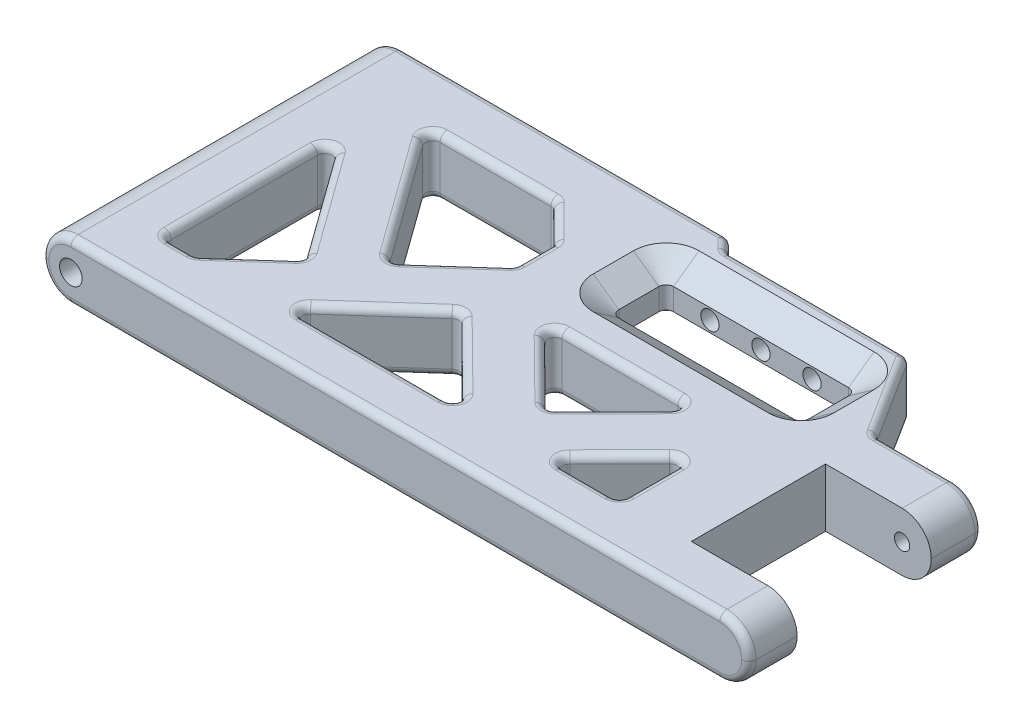
from build123d import *
from OCP.BRepFilletAPI import BRepFilletAPI_MakeChamfer

# Parameters (mm, degrees)
BOSS_EXTRU_1_DEPTH                            = 4
BOSS_EXTRU_1_DEPTH_BACK                       = 4
CONG_1_R                                      = 4
CONG_2_R                                      = 1
CHANFREIN2_SIZE                               = 3.5
CHANFREIN2_SIZE2                              = 2.5
CHANFREIN3_SIZE                               = 2.5
CHANFREIN3_SIZE2                              = 3.5
ENL_V_MAT_EXTRU_1_DEPTH                       = 21.75
ENL_V_MAT_EXTRU_1_DEPTH_BACK                  = 100.712398932
ESQUISSE6_R                                   = 1.05
ENL_V_MAT_EXTRU_2_DEPTH                       = 100.712398932
ENL_V_MAT_EXTRU_2_DEPTH_BACK                  = 100.712398932
ESQUISSE10_R                                  = 1.55
TROU_TARAUD_M31_D                             = 2.5
TROU_TARAUD_M31_DEPTH                         = 16
TROU_TARAUD_M31_TIP                           = 0.751075774
TROU_POUR_TARAUDAGE_POUR_TROU_TARAUD_M3_D     = 2.7
TROU_POUR_TARAUDAGE_POUR_TROU_TARAUD_M3_DEPTH = 3
TROU_POUR_TARAUDAGE_POUR_TROU_TARAUD_M3_TIP   = 0.811161836


with BuildPart() as part:
    # Esquisse1 → Boss.-Extru.1 (new, two sides: drawn at the far end of the back side and taken through both)
    with BuildSketch(Plane(origin=(0, 0, 0), x_dir=(1, 0, 0), z_dir=(0, 1, 0)).offset(-BOSS_EXTRU_1_DEPTH_BACK)):
        with BuildLine():
            Line((97, 2.25), (97, 9.25))
            Line((97, 9.25), (83, 9.25))
            ThreePointArc((83, 9.25), (82.517410597, 9.374153285), (82.154651314, 9.715785063))
            Line((82.154651314, 9.715785063), (75.381179686, 20.434214937))
            ThreePointArc((75.381179686, 20.434214937), (75.018420403, 20.775846715), (74.535831, 20.9))
            Line((74.535831, 20.9), (50.90856897, 20.9))
            ThreePointArc((50.90856897, 20.9), (50.520605187, 20.978325381), (50.193416227, 21.201031793))
            Line((50.193416227, 21.201031793), (48.973721713, 22.448968207))
            ThreePointArc((48.973721713, 22.448968207), (48.646532753, 22.671674619), (48.25856897, 22.75))
            Line((48.25856897, 22.75), (0, 22.75))
            Line((0, 22.75), (0, -22.75))
            Line((0, -22.75), (97, -22.75))
            Line((97, -22.75), (97, -16.15))
            Line((97, -16.15), (82.5, -16.15))
            Line((82.5, -16.15), (82.5, 2.25))
            Line((82.5, 2.25), (97, 2.25))
        make_face()
        with BuildLine():
            Line((32.085786438, 15), (16.886496815, 15))
            ThreePointArc((16.886496815, 15), (15.996263739, 14.455505292), (16.075485061, 13.414970141))
            Line((16.075485061, 13.414970141), (27.680020432, -2.672096946))
            ThreePointArc((27.680020432, -2.672096946), (28.38275435, -3.081187759), (29.157080518, -2.832975673))
            Line((29.157080518, -2.832975673), (37.166048333, 4.318516825))
            ThreePointArc((37.166048333, 4.318516825), (37.412701576, 4.655798646), (37.5, 5.064425411))
            Line((37.5, 5.064425411), (37.5, 9.585786438))
            ThreePointArc((37.5, 9.585786438), (37.423879533, 9.96846987), (37.207106781, 10.292893219))
            Line((37.207106781, 10.292893219), (32.792893219, 14.707106781))
            ThreePointArc((32.792893219, 14.707106781), (32.46846987, 14.923879533), (32.085786438, 15))
        make_face(mode=Mode.SUBTRACT)
        with BuildLine():
            Line((21.80245122, -8.19869057), (11.811011754, 5.652183408))
            ThreePointArc((11.811011754, 5.652183408), (10.692601036, 6.018734275), (10, 5.067153549))
            Line((10, 5.067153549), (10, -15))
            ThreePointArc((10, -15), (10.292893219, -15.707106781), (11, -16))
            Line((11, -16), (14.029818095, -16))
            ThreePointArc((14.029818095, -16), (14.386252811, -15.93432023), (14.695866427, -15.745908586))
            Line((14.695866427, -15.745908586), (21.657487799, -9.529629014))
            ThreePointArc((21.657487799, -9.529629014), (21.985560138, -8.891998264), (21.80245122, -8.19869057))
        make_face(mode=Mode.SUBTRACT)
        with BuildLine():
            Line((38.631997686, -5.097659646), (28.377695197, -14.254091414))
            ThreePointArc((28.377695197, -14.254091414), (28.109423299, -15.356434716), (29.04374353, -16))
            Line((29.04374353, -16), (48.565566376, -16))
            ThreePointArc((48.565566376, -16), (49.490595403, -15.379896431), (49.268396828, -14.288642597))
            Line((49.268396828, -14.288642597), (40.000876471, -5.132210828))
            ThreePointArc((40.000876471, -5.132210828), (39.323278481, -4.843886621), (38.631997686, -5.097659646))
        make_face(mode=Mode.SUBTRACT)
        with BuildLine():
            Line((47.921066285, -1.711357403), (55.94632476, -9.640418125))
            ThreePointArc((55.94632476, -9.640418125), (56.655184678, -9.929042544), (57.360512616, -9.631891174))
            Line((57.360512616, -9.631891174), (65.194528694, -1.702830452))
            ThreePointArc((65.194528694, -1.702830452), (65.405892932, -0.614533044), (64.483171291, 0))
            Line((64.483171291, 0), (48.623896738, 0))
            ThreePointArc((48.623896738, 0), (47.69886771, -0.620103569), (47.921066285, -1.711357403))
        make_face(mode=Mode.SUBTRACT)
        with BuildLine():
            Line((48.5, 15.4), (72.5, 15.4))
            ThreePointArc((72.5, 15.4), (73.207106781, 15.107106781), (73.5, 14.4))
            Line((73.5, 14.4), (73.5, 8.9))
            ThreePointArc((73.5, 8.9), (73.207106781, 8.192893219), (72.5, 7.9))
            Line((72.5, 7.9), (48.5, 7.9))
            ThreePointArc((48.5, 7.9), (47.792893219, 8.192893219), (47.5, 8.9))
            Line((47.5, 8.9), (47.5, 14.4))
            ThreePointArc((47.5, 14.4), (47.792893219, 15.107106781), (48.5, 15.4))
        make_face(mode=Mode.SUBTRACT)
        with BuildLine():
            Line((64.708618676, -16), (71.5, -16))
            ThreePointArc((71.5, -16), (72.207106781, -15.707106781), (72.5, -15))
            Line((72.5, -15), (72.5, -8.126223591))
            ThreePointArc((72.5, -8.126223591), (71.879896431, -7.201194564), (70.788642597, -7.423393139))
            Line((70.788642597, -7.423393139), (63.997261272, -14.297169548))
            ThreePointArc((63.997261272, -14.297169548), (63.785897035, -15.385466956), (64.708618676, -16))
        make_face(mode=Mode.SUBTRACT)
    extrude(amount=BOSS_EXTRU_1_DEPTH + BOSS_EXTRU_1_DEPTH_BACK)

    # Congé1
    cong_1_edges = [part.edges().sort_by_distance(p)[0] for p in [
        (0, 4, 0),
        (97, -4, -5.75),
        (97, -4, 19.45),
        (97, 4, 19.45),
        (97, 4, -5.75),
        (0, -4, 0),
    ]]
    fillet(cong_1_edges, radius=CONG_1_R - 0.0001)  # a hair under: the kernel refuses the full size

    # Congé2
    cong_2_edges = [part.edges().sort_by_distance(p)[0] for p in [
        (47.69886771, -4, 0.620103569),
        (56.553534014, -4, 0),
        (65.405892932, -4, 0.614533044),
        (61.277520655, -4, 5.667360813),
        (56.655184678, -4, 9.929042544),
        (51.933695523, -4, 5.675887764),
        (63.785897035, -4, 15.385466956),
        (67.392951935, -4, 10.860281343),
        (71.879896431, -4, 7.201194564),
        (72.5, -4, 11.563111796),
        (72.207106781, -4, 15.707106781),
        (68.104309338, -4, 16),
        (82.517410597, 4, -9.374153285),
        (78.7679155, 4, -15.075),
        (75.018420403, 4, -20.775846715),
        (62.722199985, 4, -20.9),
        (50.520605187, 4, -20.978325381),
        (49.58356897, 4, -21.825),
        (48.646532753, 4, -22.671674619),
        (26.129234485, 4, -22.75),
        (32.46846987, 4, -14.923879533),
        (24.486141626, 4, -15),
        (15.996263739, 4, -14.455505292),
        (21.877752746, 4, -5.371436598),
        (28.38275435, 4, 3.081187759),
        (33.161564425, 4, -0.742770576),
        (37.412701576, 4, -4.655798646),
        (37.5, 4, -7.325105925),
        (37.423879533, 4, -9.96846987),
        (35, 4, -12.5),
        (21.985560138, 4, 8.891998264),
        (16.806731487, 4, 1.273253581),
        (10.692601036, 4, -6.018734275),
        (10, 4, 4.966423225),
        (10.292893219, 4, 15.707106781),
        (12.514909047, 4, 16),
        (14.386252811, 4, 15.93432023),
        (18.176677113, 4, 12.6377688),
        (39.323278481, 4, 4.843886621),
        (33.504846441, 4, 9.67587553),
        (28.109423299, 4, 15.356434716),
        (38.804654953, 4, 16),
        (49.490595403, 4, 15.379896431),
        (44.634636649, 4, 9.710426713),
        (47.69886771, 4, 0.620103569),
        (51.933695523, 4, 5.675887764),
        (56.655184678, 4, 9.929042544),
        (61.277520655, 4, 5.667360813),
        (65.405892932, 4, 0.614533044),
        (56.553534014, 4, 0),
        (63.785897035, 4, 15.385466956),
        (68.104309338, 4, 16),
        (72.207106781, 4, 15.707106781),
        (72.5, 4, 11.563111796),
        (71.879896431, 4, 7.201194564),
        (67.392951935, 4, 10.860281343),
        (82.517410597, -4, -9.374153285),
        (88.00005, 4, -9.25),
        (88.00005, -4, -9.25),
        (95.828456414, 2.828456414, -9.25),
        (95.828456414, -2.828456414, -9.25),
        (78.7679155, -4, -15.075),
        (48.5, -4, 22.75),
        (48.5, 4, 22.75),
        (1.171543586, 2.828456414, 22.75),
        (1.171543586, -2.828456414, 22.75),
        (95.828456414, 2.828456414, 22.75),
        (95.828456414, -2.828456414, 22.75),
        (1.171543586, 2.828456414, -22.75),
        (1.171543586, -2.828456414, -22.75),
        (75.018420403, -4, -20.775846715),
        (62.722199985, -4, -20.9),
        (50.520605187, -4, -20.978325381),
        (49.58356897, -4, -21.825),
        (48.646532753, -4, -22.671674619),
        (32.46846987, -4, -14.923879533),
        (35, -4, -12.5),
        (37.423879533, -4, -9.96846987),
        (37.5, -4, -7.325105925),
        (37.412701576, -4, -4.655798646),
        (33.161564425, -4, -0.742770576),
        (28.38275435, -4, 3.081187759),
        (21.877752746, -4, -5.371436598),
        (26.129234485, -4, -22.75),
        (15.996263739, -4, -14.455505292),
        (24.486141626, -4, -15),
        (21.985560138, -4, 8.891998264),
        (18.176677113, -4, 12.6377688),
        (14.386252811, -4, 15.93432023),
        (12.514909047, -4, 16),
        (10.292893219, -4, 15.707106781),
        (10, -4, 4.966423225),
        (10.692601036, -4, -6.018734275),
        (16.806731487, -4, 1.273253581),
        (39.323278481, -4, 4.843886621),
        (44.634636649, -4, 9.710426713),
        (49.490595403, -4, 15.379896431),
        (38.804654953, -4, 16),
        (28.109423299, -4, 15.356434716),
        (33.504846441, -4, 9.67587553),
    ]]
    fillet(cong_2_edges, radius=CONG_2_R)

    # Chanfrein2
    chanfrein2_edges = [part.edges().sort_by_distance(p)[0] for p in [
        (47.792893219, 4, -15.107106781),
        (47.5, 4, -11.65),
        (47.792893219, 4, -8.192893219),
        (60.5, 4, -7.9),
        (73.207106781, 4, -8.192893219),
        (73.5, 4, -11.65),
        (73.207106781, 4, -15.107106781),
        (60.5, 4, -15.4),
    ]]
    chanfrein2_side = [part.faces().sort_by_distance(p)[0] for p in [
        (46.216457966, 4, 0.985552586),
    ]]
    chamfer(chanfrein2_edges, length=CHANFREIN2_SIZE, length2=CHANFREIN2_SIZE2, reference=chanfrein2_side[0])

    # Chanfrein3: one chamfer whose edges measure the first distance from different faces: ONE call of the kernel's chamfer builder (chamfer() names one face for all edges)
    chanfrein3_edges_1 = [part.edges().sort_by_distance(p)[0] for p in [
        (47.792893219, -4, -15.107106781),
    ]]
    chanfrein3_side_1 = [part.faces().sort_by_distance(p)[0] for p in [
        (47.792893219, -1.25, -15.107106781),
    ]]
    chanfrein3_edges_2 = [part.edges().sort_by_distance(p)[0] for p in [
        (60.5, -4, -15.4),
    ]]
    chanfrein3_side_2 = [part.faces().sort_by_distance(p)[0] for p in [
        (60.5, -1.25, -15.4),
    ]]
    chanfrein3_edges_3 = [part.edges().sort_by_distance(p)[0] for p in [
        (73.207106781, -4, -15.107106781),
    ]]
    chanfrein3_side_3 = [part.faces().sort_by_distance(p)[0] for p in [
        (73.207106781, -1.25, -15.107106781),
    ]]
    chanfrein3_edges_4 = [part.edges().sort_by_distance(p)[0] for p in [
        (73.5, -4, -11.65),
    ]]
    chanfrein3_side_4 = [part.faces().sort_by_distance(p)[0] for p in [
        (73.5, -1.25, -11.65),
    ]]
    chanfrein3_edges_5 = [part.edges().sort_by_distance(p)[0] for p in [
        (73.207106781, -4, -8.192893219),
    ]]
    chanfrein3_side_5 = [part.faces().sort_by_distance(p)[0] for p in [
        (73.207106781, -1.25, -8.192893219),
    ]]
    chanfrein3_edges_6 = [part.edges().sort_by_distance(p)[0] for p in [
        (60.5, -4, -7.9),
    ]]
    chanfrein3_side_6 = [part.faces().sort_by_distance(p)[0] for p in [
        (60.5, -1.25, -7.9),
    ]]
    chanfrein3_edges_7 = [part.edges().sort_by_distance(p)[0] for p in [
        (47.792893219, -4, -8.192893219),
    ]]
    chanfrein3_side_7 = [part.faces().sort_by_distance(p)[0] for p in [
        (47.792893219, -1.25, -8.192893219),
    ]]
    chanfrein3_edges_8 = [part.edges().sort_by_distance(p)[0] for p in [
        (47.5, -4, -11.65),
    ]]
    chanfrein3_side_8 = [part.faces().sort_by_distance(p)[0] for p in [
        (47.5, -1.25, -11.65),
    ]]
    chanfrein3 = BRepFilletAPI_MakeChamfer(part.part.solid().wrapped)
    for e in chanfrein3_edges_1:
        chanfrein3.Add(CHANFREIN3_SIZE, CHANFREIN3_SIZE2, e.wrapped, chanfrein3_side_1[0].wrapped)  # the first distance lies on this face
    for e in chanfrein3_edges_2:
        chanfrein3.Add(CHANFREIN3_SIZE, CHANFREIN3_SIZE2, e.wrapped, chanfrein3_side_2[0].wrapped)  # the first distance lies on this face
    for e in chanfrein3_edges_3:
        chanfrein3.Add(CHANFREIN3_SIZE, CHANFREIN3_SIZE2, e.wrapped, chanfrein3_side_3[0].wrapped)  # the first distance lies on this face
    for e in chanfrein3_edges_4:
        chanfrein3.Add(CHANFREIN3_SIZE, CHANFREIN3_SIZE2, e.wrapped, chanfrein3_side_4[0].wrapped)  # the first distance lies on this face
    for e in chanfrein3_edges_5:
        chanfrein3.Add(CHANFREIN3_SIZE, CHANFREIN3_SIZE2, e.wrapped, chanfrein3_side_5[0].wrapped)  # the first distance lies on this face
    for e in chanfrein3_edges_6:
        chanfrein3.Add(CHANFREIN3_SIZE, CHANFREIN3_SIZE2, e.wrapped, chanfrein3_side_6[0].wrapped)  # the first distance lies on this face
    for e in chanfrein3_edges_7:
        chanfrein3.Add(CHANFREIN3_SIZE, CHANFREIN3_SIZE2, e.wrapped, chanfrein3_side_7[0].wrapped)  # the first distance lies on this face
    for e in chanfrein3_edges_8:
        chanfrein3.Add(CHANFREIN3_SIZE, CHANFREIN3_SIZE2, e.wrapped, chanfrein3_side_8[0].wrapped)  # the first distance lies on this face
    add(Compound.cast(chanfrein3.Shape()), mode=Mode.REPLACE)

    # Esquisse6 → Enlèv. mat.-Extru.1 (cut, two sides: drawn at the far end of the back side and taken through both)
    with BuildSketch(Plane.XY.offset(-ENL_V_MAT_EXTRU_1_DEPTH_BACK)):
        with Locations((93, 0)):
            Circle(ESQUISSE6_R)
    extrude(amount=ENL_V_MAT_EXTRU_1_DEPTH + ENL_V_MAT_EXTRU_1_DEPTH_BACK, mode=Mode.SUBTRACT)

    # Esquisse10 → Enlèv. mat.-Extru.2 (cut, two sides: drawn at the far end of the back side and taken through both)
    with BuildSketch(Plane.XY.offset(-ENL_V_MAT_EXTRU_2_DEPTH_BACK)):
        with Locations((4, 0)):
            Circle(ESQUISSE10_R)
    extrude(amount=ENL_V_MAT_EXTRU_2_DEPTH + ENL_V_MAT_EXTRU_2_DEPTH_BACK, mode=Mode.SUBTRACT)

    # Trou taraudé M31
    with Locations(Plane(origin=(0, 0, -20.9), x_dir=(-1, 0, 0), z_dir=(0, 0, -1))):
        with Locations((-60.5, 0), (-53.5, 0), (-67.5, 0)):
            Hole(TROU_TARAUD_M31_D / 2, depth=TROU_TARAUD_M31_DEPTH)
            with Locations((0, 0, -(TROU_TARAUD_M31_DEPTH + TROU_TARAUD_M31_TIP / 2))):  # 118° drill point
                Cone(0, TROU_TARAUD_M31_D / 2, TROU_TARAUD_M31_TIP, mode=Mode.SUBTRACT)

    # Trou pour taraudage pour trou taraudé M31
    with Locations(Plane(origin=(0, 0, -9.25), x_dir=(-1, 0, 0), z_dir=(0, 0, -1))):
        with Locations((-93, 0)):
            Hole(TROU_POUR_TARAUDAGE_POUR_TROU_TARAUD_M3_D / 2, depth=TROU_POUR_TARAUDAGE_POUR_TROU_TARAUD_M3_DEPTH)
            with Locations((0, 0, -(TROU_POUR_TARAUDAGE_POUR_TROU_TARAUD_M3_DEPTH + TROU_POUR_TARAUDAGE_POUR_TROU_TARAUD_M3_TIP / 2))):  # 118° drill point
                Cone(0, TROU_POUR_TARAUDAGE_POUR_TROU_TARAUD_M3_D / 2, TROU_POUR_TARAUDAGE_POUR_TROU_TARAUD_M3_TIP, mode=Mode.SUBTRACT)


solid = part.part
